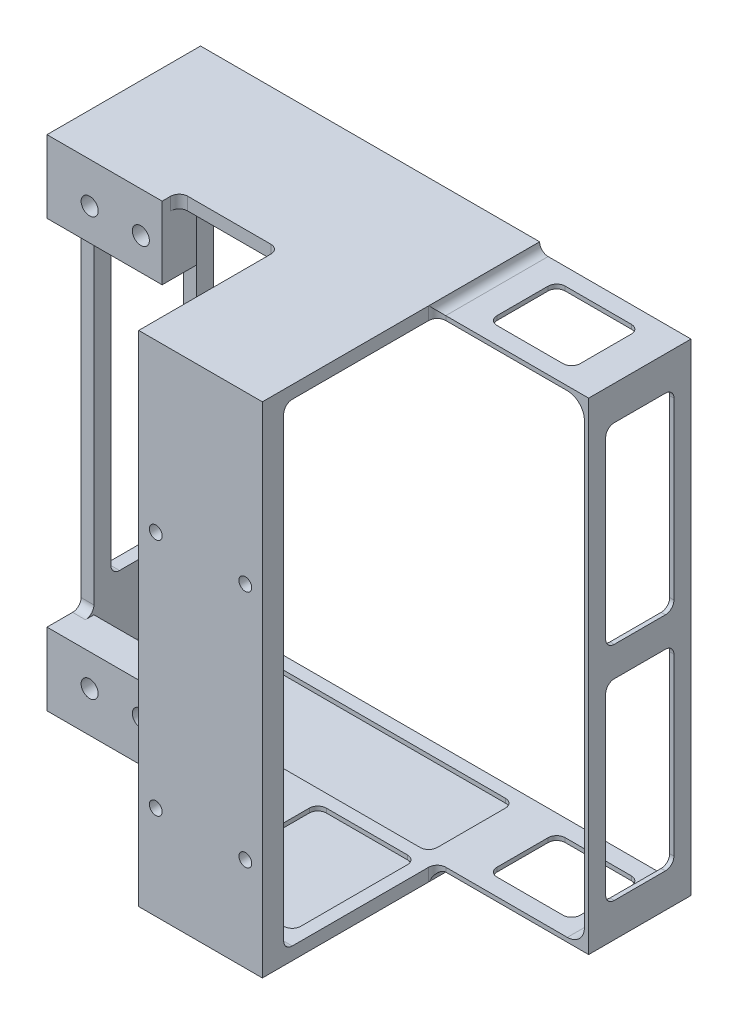
from build123d import *

# Parameters (mm, degrees)
SKETCH2_W                          = 113
SKETCH2_H                          = 113
SKETCH2_W_2                        = 107
SKETCH2_H_2                        = 107
BOSS_EXTRUDE1_DEPTH                = 11
SKETCH3_W                          = 40
SKETCH3_H                          = 30
BOSS_EXTRUDE2_DEPTH                = 2
BOSS_EXTRUDE5_DEPTH                = 50
BOSS_EXTRUDE5_DEPTH_BACK           = 10
SKETCH6_W                          = 24
SKETCH6_H                          = 2
BOSS_EXTRUDE6_DEPTH                = 5
BOSS_EXTRUDE7_DEPTH                = 4
SKETCH12_R                         = 1.5
CUT_EXTRUDE1_DEPTH                 = 131.228645082
SKETCH17_W                         = 110.474014848
SKETCH17_H                         = 62.958309537
REMOVAL_OF_BATTERY_EXTENSION_DEPTH = 141.257798357
SKETCH18_W                         = 113
SKETCH18_H                         = 113
SKETCH18_W_2                       = 107
SKETCH18_H_2                       = 107
EXTEND_WALLS_DEPTH                 = 10
BOSS_EXTRUDE10_REACH               = 96.438
SKETCH22_W                         = 24
SKETCH22_H                         = 3
BOSS_EXTRUDE11_DEPTH               = 7
SKETCH24_W                         = 27
SKETCH24_H                         = 15
BOSS_EXTRUDE12_DEPTH               = 8
SKETCH25_R                         = 2
CUT_EXTRUDE4_DEPTH                 = 9
BOSS_EXTRUDE13_DEPTH               = 2
BOSS_EXTRUDE14_DEPTH               = 2
SKETCH29_W                         = 26.5
SKETCH29_H                         = 5
BOSS_EXTRUDE15_DEPTH               = 4
BOSS_EXTRUDE16_DEPTH               = 2
BOSS_EXTRUDE17_REACH               = 104.198
SKETCH31_W                         = 5
SKETCH31_H                         = 5
CUT_EXTRUDE5_DEPTH                 = 4
SKETCH33_W                         = 29
SKETCH33_H                         = 4
CUT_EXTRUDE6_DEPTH                 = 110
CUT_EXTRUDE7_DEPTH                 = 10
SKETCH35_W                         = 19.5
SKETCH35_H                         = 16
CUT_EXTRUDE8_DEPTH                 = 141.257798357
SKETCH37_W                         = 4
SKETCH37_H                         = 117
CUT_EXTRUDE13_DEPTH                = 2
SKETCH38_W                         = 2
SKETCH38_H                         = 12
CUT_EXTRUDE14_DEPTH                = 10
FILLET1_R                          = 2
CUT_EXTRUDE15_DEPTH                = 10
FILLET2_R                          = 2
SKETCH40_W                         = 23
SKETCH40_H                         = 29
SKETCH40_W_2                       = 66.5
SKETCH40_H_2                       = 20
CUT_EXTRUDE16_DEPTH                = 56.5
FILLET3_R                          = 2
FILLET4_R                          = 2
CUT_EXTRUDE20_DEPTH                = 63
CUT_EXTRUDE21_DEPTH                = 32
FILLET6_R                          = 2


with BuildPart() as part:
    # Sketch2 → Boss-Extrude1 (new body)
    with BuildSketch(Plane.XY):
        Rectangle(SKETCH2_W, SKETCH2_H)
        Rectangle(SKETCH2_W_2, SKETCH2_H_2, mode=Mode.SUBTRACT)
    extrude(amount=BOSS_EXTRUDE1_DEPTH)

    # Sketch3 → Boss-Extrude2 (add)
    with BuildSketch(Plane.XY):
        with Locations((-76.5, 0)):
            Rectangle(SKETCH3_W, SKETCH3_H)
    extrude(amount=BOSS_EXTRUDE2_DEPTH)

    # Sketch6 → Boss-Extrude5 (add, two sides: drawn at the far end of the back side and taken through both)
    with BuildSketch(Plane.XY.offset(-BOSS_EXTRUDE5_DEPTH_BACK)):
        with Locations((9, -57.5)):
            Rectangle(SKETCH6_W, SKETCH6_H)
        with Locations((9, 57.5)):
            Rectangle(SKETCH6_W, SKETCH6_H)
    extrude(amount=BOSS_EXTRUDE5_DEPTH + BOSS_EXTRUDE5_DEPTH_BACK)

    # Sketch8 → Boss-Extrude6 (add)
    with BuildSketch(Plane.XY.offset(50)):
        Polygon((-3, 58.5), (-8, 58.5), (-8, -58.5), (-3, -58.5), (21, -58.5), (21, 58.5), align=None)
    extrude(amount=BOSS_EXTRUDE6_DEPTH)

    # Sketch9 → Boss-Extrude7 (add)
    with BuildSketch(Plane.XY.offset(55)):
        Polygon((-3, 58.5), (-8, 58.5), (-8, 43.5), (21, 43.5), (21, 54.5), (21, 56.5), (21, 58.5), align=None)
        Polygon((-3, -58.5), (21, -58.5), (21, -56.5), (21, -54.5), (21, -43.5), (-8, -43.5), (-8, -58.5), align=None)
    extrude(amount=BOSS_EXTRUDE7_DEPTH)

    # Sketch12 → Cut-Extrude1 (cut, through all)
    with BuildSketch(Plane.XY.offset(55)):
        with Locations((17, 19.5)):
            Circle(SKETCH12_R)
        with Locations((-4, 19.5)):
            Circle(SKETCH12_R)
        with Locations((17, -36.5)):
            Circle(SKETCH12_R)
        with Locations((-4, -36.5)):
            Circle(SKETCH12_R)
    extrude(amount=-CUT_EXTRUDE1_DEPTH, mode=Mode.SUBTRACT)

    # Sketch17 → removal of battery extension (cut, through all)
    with BuildSketch(Plane.ZY.offset(56.5)):
        with Locations((34.263645264, -0.593946317)):
            Rectangle(SKETCH17_W, SKETCH17_H)
    extrude(amount=REMOVAL_OF_BATTERY_EXTENSION_DEPTH, mode=Mode.SUBTRACT)

    # Sketch18 → Extend walls (add)
    with BuildSketch(Plane(origin=(0, 0, 0), x_dir=(-1, 0, 0), z_dir=(0, 0, -1))):
        Rectangle(SKETCH18_W, SKETCH18_H)
        Rectangle(SKETCH18_W_2, SKETCH18_H_2, mode=Mode.SUBTRACT)
    extrude(amount=EXTEND_WALLS_DEPTH)

    # Sketch22 → Boss-Extrude10 (add, up to next)
    with BuildSketch(Plane.XY.offset(11), mode=Mode.PRIVATE) as boss_extrude10_sk1:
        with Locations((9, 55)):
            Rectangle(SKETCH22_W, SKETCH22_H)
    boss_extrude10_tool1 = extrude(boss_extrude10_sk1.sketch, amount=BOSS_EXTRUDE10_REACH, mode=Mode.PRIVATE) - part.part
    # Sketch22 → Boss-Extrude10 (add, up to next)
    with BuildSketch(Plane.XY.offset(11), mode=Mode.PRIVATE) as boss_extrude10_sk2:
        with Locations((9, -55)):
            Rectangle(SKETCH22_W, SKETCH22_H)
    boss_extrude10_tool2 = extrude(boss_extrude10_sk2.sketch, amount=BOSS_EXTRUDE10_REACH, mode=Mode.PRIVATE) - part.part
    add(boss_extrude10_tool1.solids().sort_by_distance((9, 55, 11))[0])
    add(boss_extrude10_tool2.solids().sort_by_distance((9, -55, 11))[0])

    # Sketch23 → Boss-Extrude11 (add)
    with BuildSketch(Plane.XY.offset(11)):
        Polygon((21, -56.5), (21, -53.5), (53.5, -53.5), (53.5, 53.5), (21, 53.5), (21, 56.5), (56.5, 56.5), (56.5, -56.5), align=None)
        Polygon((-3, 53.5), (-3, 56.5), (-56.5, 56.5), (-56.5, -56.5), (-3, -56.5), (-3, -53.5), (-53.5, -53.5), (-53.5, 53.5), align=None)
    extrude(amount=BOSS_EXTRUDE11_DEPTH)

    # Sketch24 → Boss-Extrude12 (add)
    with BuildSketch(Plane.XY.offset(18)):
        with Locations((-43, 49)):
            Rectangle(SKETCH24_W, SKETCH24_H)
        with Locations((-43, -49)):
            Rectangle(SKETCH24_W, SKETCH24_H)
    extrude(amount=BOSS_EXTRUDE12_DEPTH)

    # Sketch25 → Cut-Extrude4 (cut)
    with BuildSketch(Plane.XY.offset(26)):
        with Locations((-48.5, 49)):
            Circle(SKETCH25_R)
        with Locations((-36.5, 49)):
            Circle(SKETCH25_R)
        with Locations((-48.5, -49)):
            Circle(SKETCH25_R)
        with Locations((-36.5, -49)):
            Circle(SKETCH25_R)
    extrude(amount=-CUT_EXTRUDE4_DEPTH, mode=Mode.SUBTRACT)

    # Sketch27 → Boss-Extrude13 (add)
    with BuildSketch(Plane(origin=(0, 56.5, 0), x_dir=(1, 0, 0), z_dir=(0, 1, 0))):
        Polygon((-29.5, -26), (-29.5, -18), (-3, -18), (-3, 10), (-56.5, 10), (-56.5, -26), align=None)
    extrude(amount=BOSS_EXTRUDE13_DEPTH)

    # Sketch28 → Boss-Extrude14 (add)
    with BuildSketch(Plane.XZ.offset(56.5)):
        Polygon((-56.5, 26), (-56.5, -10), (-3, -10), (-3, 18), (-29.5, 18), (-29.5, 26), align=None)
    extrude(amount=BOSS_EXTRUDE14_DEPTH)

    # Sketch29 → Boss-Extrude15 (add)
    with BuildSketch(Plane.XY.offset(18)):
        with Locations((-16.25, 56)):
            Rectangle(SKETCH29_W, SKETCH29_H)
        with Locations((-16.25, -56)):
            Rectangle(SKETCH29_W, SKETCH29_H)
    extrude(amount=BOSS_EXTRUDE15_DEPTH)

    # Sketch30 → Boss-Extrude16 (add)
    with BuildSketch(Plane.ZY.offset(56.5)):
        Polygon((26, 58.5), (-10, 58.5), (-10, -58.5), (26, -58.5), (26, -41.5), (18, -41.5), (18, 41.5), (26, 41.5), align=None)
    extrude(amount=BOSS_EXTRUDE16_DEPTH)

    # Sketch31 → Boss-Extrude17 (add, up to next)
    with BuildSketch(Plane(origin=(0, 0, 50), x_dir=(-1, 0, 0), z_dir=(0, 0, -1)), mode=Mode.PRIVATE) as boss_extrude17_sk1:
        with Locations((5.5, 56)):
            Rectangle(SKETCH31_W, SKETCH31_H)
    boss_extrude17_tool1 = extrude(boss_extrude17_sk1.sketch, amount=BOSS_EXTRUDE17_REACH, mode=Mode.PRIVATE) - part.part
    # Sketch31 → Boss-Extrude17 (add, up to next)
    with BuildSketch(Plane(origin=(0, 0, 50), x_dir=(-1, 0, 0), z_dir=(0, 0, -1)), mode=Mode.PRIVATE) as boss_extrude17_sk2:
        with Locations((5.5, -56)):
            Rectangle(SKETCH31_W, SKETCH31_H)
    boss_extrude17_tool2 = extrude(boss_extrude17_sk2.sketch, amount=BOSS_EXTRUDE17_REACH, mode=Mode.PRIVATE) - part.part
    add(boss_extrude17_tool1.solids().sort_by_distance((-5.5, 56, 50))[0])
    add(boss_extrude17_tool2.solids().sort_by_distance((-5.5, -56, 50))[0])

    # Sketch32 → Cut-Extrude5 (cut)
    with BuildSketch(Plane.XY.offset(18)):
        Polygon((21, -56.5), (21, -53.5), (53.5, -53.5), (53.5, 53.5), (21, 53.5), (21, 56.5), (56.5, 56.5), (56.5, -56.5), align=None)
    extrude(amount=-CUT_EXTRUDE5_DEPTH, mode=Mode.SUBTRACT)

    # Sketch33 → Cut-Extrude6 (cut, symmetric)
    with BuildSketch(Plane(origin=(0, -43.5, 0), x_dir=(1, 0, 0), z_dir=(0, 1, 0))):
        with Locations((6.5, -57)):
            Rectangle(SKETCH33_W, SKETCH33_H)
    extrude(amount=CUT_EXTRUDE6_DEPTH, both=True, mode=Mode.SUBTRACT)

    # Sketch34 → Cut-Extrude7 (cut)
    with BuildSketch(Plane(origin=(56.5, 0, 0), x_dir=(0, 0, -1), z_dir=(1, 0, 0))):
        Polygon((-2, -48.5), (-10, -48.5), (-10, -3.5), (6, -3.5), (6, -48.5), align=None)
        Polygon((6, 3.5), (6, 48.5), (-2, 48.5), (-10, 48.5), (-10, 3.5), align=None)
    extrude(amount=-CUT_EXTRUDE7_DEPTH, mode=Mode.SUBTRACT)

    # Sketch35 → Cut-Extrude8 (cut, through all)
    with BuildSketch(Plane.XZ.offset(56.5)):
        with Locations((38.75, 2)):
            Rectangle(SKETCH35_W, SKETCH35_H)
    extrude(amount=-CUT_EXTRUDE8_DEPTH, mode=Mode.SUBTRACT)

    # Sketch37 → Cut-Extrude13 (cut)
    with BuildSketch(Plane(origin=(-29.5, 0, 0), x_dir=(0, 0, -1), z_dir=(1, 0, 0))):
        with Locations((-24, 0)):
            Rectangle(SKETCH37_W, SKETCH37_H)
    extrude(amount=-CUT_EXTRUDE13_DEPTH, mode=Mode.SUBTRACT)

    # Sketch38 → Cut-Extrude14 (cut)
    with BuildSketch(Plane.XY.offset(22)):
        with Locations((-30.5, -47.5)):
            Rectangle(SKETCH38_W, SKETCH38_H)
        with Locations((-30.5, 47.5)):
            Rectangle(SKETCH38_W, SKETCH38_H)
    extrude(amount=-CUT_EXTRUDE14_DEPTH, mode=Mode.SUBTRACT)

    # Fillet1
    fillet1_edges = [part.edges().sort_by_distance(p)[0] for p in [
        (-42.5, 53.5, 18),
        (-42.5, -53.5, 18),
        (-56, -41.5, 18),
        (-56, 41.5, 18),
        (-31.5, 53.5, 20),
        (-31.5, 56, 22),
        (-8, 56, 22),
        (-31.5, -53.5, 20),
        (-31.5, -56, 22),
        (-8, -56, 22),
        (-53.5, -53.5, 4),
        (-53.5, 53.5, 4),
        (53.5, 53.5, 2),
        (53.5, -53.5, 2),
        (48.5, -55, 10),
        (48.5, -55, -6),
        (29, -55, 10),
        (29, -55, -6),
        (55, -48.5, -6),
        (55, -3.5, -6),
        (55, -3.5, 10),
        (55, -48.5, 10),
        (55, 3.5, 10),
        (55, 3.5, -6),
        (55, 48.5, 10),
        (55, 48.5, -6),
        (29, 55, -6),
        (48.5, 55, -6),
        (48.5, 55, 10),
        (29, 55, 10),
        (21, 56.5, 2),
        (21, 55, 14),
        (21, -56.5, 2),
        (21, -55, 14),
        (6.5, 53.5, 50),
        (6.5, -53.5, 50),
    ]]
    fillet(fillet1_edges, radius=FILLET1_R - 0.0001)  # a hair under: the kernel refuses the full size

    # Sketch39 → Cut-Extrude15 (cut)
    with BuildSketch(Plane.ZY.offset(58.5)):
        Polygon((14, -0.715568725), (14, -35.5), (-6, -35.5), (-6, 35.5), (14, 35.5), align=None)
    extrude(amount=-CUT_EXTRUDE15_DEPTH, mode=Mode.SUBTRACT)

    # Fillet2
    fillet2_edges = [part.edges().sort_by_distance(p)[0] for p in [
        (-56, 35.5, 14),
        (-56, -35.5, 14),
        (-56, -35.5, -6),
        (-56, 35.5, -6),
    ]]
    fillet(fillet2_edges, radius=FILLET2_R)

    # Sketch40 → Cut-Extrude16 (cut, symmetric)
    with BuildSketch(Plane(origin=(0, 0, 0), x_dir=(1, 0, 0), z_dir=(0, 1, 0))):
        with Locations((6.5, -30.5)):
            Rectangle(SKETCH40_W, SKETCH40_H)
        with Locations((-15.25, -3)):
            Rectangle(SKETCH40_W_2, SKETCH40_H_2)
    extrude(amount=CUT_EXTRUDE16_DEPTH, both=True, mode=Mode.SUBTRACT)

    # Fillet3
    fillet3_edges = [part.edges().sort_by_distance(p)[0] for p in [
        (18, 55, 45),
        (-5, 55, 45),
        (-5, 55, 16),
        (18, -55, 16),
        (18, -55, 45),
        (-5, -55, 45),
        (-5, -55, 16),
        (-48.5, 55, 13),
        (-48.5, 55, -7),
        (18, 55, -7),
        (18, 55, 13),
        (-48.5, -55, 13),
        (-48.5, -55, -7),
        (18, -55, -7),
        (18, -55, 13),
    ]]
    fillet(fillet3_edges, radius=FILLET3_R)

    # Fillet4
    fillet4_edges = [part.edges().sort_by_distance(p)[0] for p in [
        (18, 55, 16),
    ]]
    fillet(fillet4_edges, radius=FILLET4_R)

    # Sketch42 → Cut-Extrude20 (cut)
    with BuildSketch(Plane(origin=(0, 0, 18), x_dir=(-1, 0, 0), z_dir=(0, 0, -1))):
        with BuildLine():
            Line((-55.5, 51.5), (-55.5, -51.5))
            ThreePointArc((-55.5, -51.5), (-54.328427125, -54.328427125), (-51.5, -55.5))
            Line((-51.5, -55.5), (51.5, -55.5))
            ThreePointArc((51.5, -55.5), (54.328427125, -54.328427125), (55.5, -51.5))
            Line((55.5, -51.5), (55.5, 51.5))
            ThreePointArc((55.5, 51.5), (54.328427125, 54.328427125), (51.5, 55.5))
            Line((51.5, 55.5), (-51.5, 55.5))
            ThreePointArc((-51.5, 55.5), (-54.328427125, 54.328427125), (-55.5, 51.5))
        make_face()
    extrude(amount=CUT_EXTRUDE20_DEPTH, mode=Mode.SUBTRACT)

    # Sketch44 → Cut-Extrude21 (cut)
    with BuildSketch(Plane(origin=(0, 0, 18), x_dir=(-1, 0, 0), z_dir=(0, 0, -1))):
        Polygon((55.5, 41.5), (55.5, -41.5), (31.5, -41.5), (31.5, -55.5), (-21, -55.5), (-21, 55.5), (31.5, 55.5), (31.5, 53.5), (31.5, 41.5), align=None)
    extrude(amount=-CUT_EXTRUDE21_DEPTH, mode=Mode.SUBTRACT)

    # Fillet6
    fillet6_edges = [part.edges().sort_by_distance(p)[0] for p in [
        (6.5, -55.5, 50),
        (6.5, 55.5, 50),
    ]]
    fillet(fillet6_edges, radius=FILLET6_R)


solid = part.part
